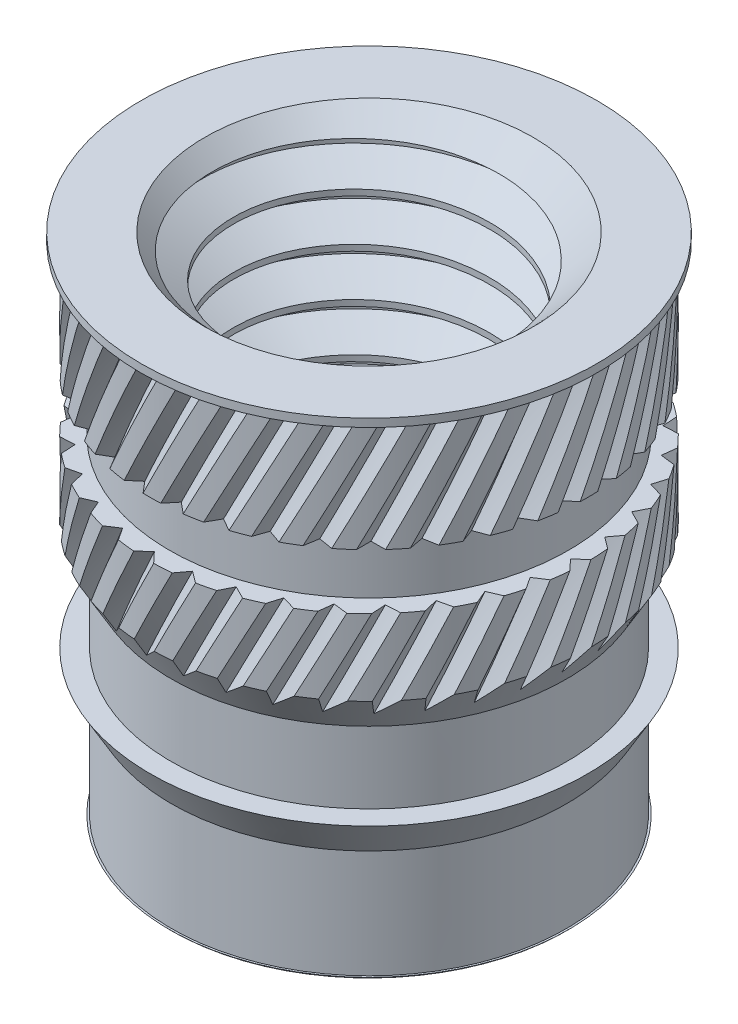
from build123d import *

# Parameters (mm, degrees)
SKETCH1_R         = 6.2
EXTRUDE1_DEPTH    = 15.88
SKETCH1_4_R       = 6.86
EXTRUDE2_DEPTH    = 7.89827
SKETCH1_3_R       = 7.15
EXTRUDE3_DEPTH    = 0.254
SKETCH2_R         = 6.86
EXTRUDE4_DEPTH    = 1.143154
EXTRUDE4_TAPER    = 30
SKETCH8_R         = 4.025721421
EXTRUDE6_DEPTH    = 15.88
CHAMFER1_SIZE     = 1.125
CUT_SWEEP1_PITCH  = 1.5
CUT_SWEEP2_PITCH  = 86.835
CIRPATTERN1_COUNT = 36
SKETCH11_W        = 0.89
SKETCH11_H        = 1.7367


with BuildPart() as part:
    # Sketch1 → Extrude1 (new body)
    with BuildSketch(Plane(origin=(0, 0, 0), x_dir=(1, 0, 0), z_dir=(0, 1, 0))):
        with Locations(Location((0, 0, 0), (0, 0, 270))):
            Circle(SKETCH1_R)
    extrude(amount=-EXTRUDE1_DEPTH)

    # Sketch1<4> → Extrude2 (add)
    with BuildSketch(Plane(origin=(0, 0, 0), x_dir=(1, 0, 0), z_dir=(0, 1, 0))):
        with Locations(Location((0, 0, 0), (0, 0, 270))):
            Circle(SKETCH1_4_R)
    extrude(amount=-EXTRUDE2_DEPTH)

    # Sketch1<3> → Extrude3 (add)
    with BuildSketch(Plane(origin=(0, 0, 0), x_dir=(1, 0, 0), z_dir=(0, 1, 0))):
        with Locations(Location((0, 0, 0), (0, 0, 270))):
            Circle(SKETCH1_3_R)
    extrude(amount=-EXTRUDE3_DEPTH)

    # Sketch2 → Extrude4 (add)
    with BuildSketch(Plane.XZ.offset(7.898269515)):
        with Locations(Location((0, 0, 0), (0, 0, 90))):
            Circle(SKETCH2_R)
    extrude(amount=EXTRUDE4_DEPTH, taper=EXTRUDE4_TAPER)

    # Extrude5: read off the stored shape, not the designer's step
    # Extrude5 outline → Extrude5 (revolve)
    with BuildSketch(Plane.XY):
        Polygon((6.2, -15.82), (6.2, -15.88), (6.26, -15.82), align=None)
    revolve(axis=Axis((0, 0, 0), (0, 1, 0)))

    # Sketch5 → Revolve1 (revolve)
    with BuildSketch(Plane.XY):
        Polygon((-6.2, -12.430711524), (-6.86, -11.287557991), (-6.2, -11.287557991), align=None)
    revolve(axis=Axis((0, 0, 0), (0, -1, 0)))

    # Sketch8 → Extrude6 (cut)
    with BuildSketch(Plane(origin=(0, 0, 0), x_dir=(1, 0, 0), z_dir=(0, 1, 0))):
        with Locations(Location((0, 0, 0), (0, 0, 270))):
            Circle(SKETCH8_R)
    extrude(amount=-EXTRUDE6_DEPTH, mode=Mode.SUBTRACT)

    # Chamfer1
    chamfer1_edges = [part.edges().sort_by_distance(p)[0] for p in [
        (0, -15.88, -4.025721421),
        (0, 0, -4.025721421),
    ]]
    chamfer(chamfer1_edges, length=CHAMFER1_SIZE)

    # Cut-Sweep1: arcs per turn and ends read off the stored shape
    # Cut-Sweep1: the profile of Sketch7 screwed along a right-hand helix through 11.796106 turns, 8 arcs to a turn; built about Z, then put on its axis
    cut_sweep1_z = Axis((0, 0, 0), (0, 0, 1))
    cut_sweep1_corners = [(5, 0, -0.75), (5, 0, -0.5625), (3.944531539, 0, 0.046875), (3.944531539, 0, -1.359375)]
    with BuildLine(mode=Mode.PRIVATE) as cut_sweep1_profile:
        Line(cut_sweep1_corners[0], cut_sweep1_corners[1])
        Line(cut_sweep1_corners[1], cut_sweep1_corners[2])
        Line(cut_sweep1_corners[2], cut_sweep1_corners[3])
        Line(cut_sweep1_corners[3], cut_sweep1_corners[0])
    cut_sweep1_cap = Face(cut_sweep1_profile.wire())
    cut_sweep1_turn_angles = [0, 22.5, 45, 67.5, 90, 112.5, 135, 157.5, 180, 202.5, 225, 247.5, 270, 292.5, 315, 337.5, 360]
    cut_sweep1_turn_weights = [1, 0.9238795325112867, 1, 0.9238795325112867, 1, 0.9238795325112867, 1, 0.9238795325112867, 1, 0.9238795325112867, 1, 0.9238795325112867, 1, 0.9238795325112867, 1, 0.9238795325112867, 1]
    cut_sweep1_turn_rails = [Edge.make_bspline([Vector(p[0], p[1], 0).rotate(cut_sweep1_z, cut_sweep1_turn_angles[k]) / cut_sweep1_turn_weights[k] + Vector(0, 0, p[2] + CUT_SWEEP1_PITCH * cut_sweep1_turn_angles[k] / 360) for k in range(17)], [0, 0, 0, 1, 1, 2, 2, 3, 3, 4, 4, 5, 5, 6, 6, 7, 7, 8, 8, 8], 2, cut_sweep1_turn_weights) for p in cut_sweep1_corners]
    cut_sweep1_turn_sides = [Face.make_surface_from_curves(cut_sweep1_turn_rails[p[0]], cut_sweep1_turn_rails[p[1]]) for p in [(0, 1), (1, 2), (2, 3), (3, 0)]]
    cut_sweep1_last_angles = [3960, 3982.5, 4005, 4027.5, 4050, 4072.5, 4095, 4117.5, 4140, 4162.5, 4185, 4207.5, 4230, 4238.299111843, 4246.598223686]
    cut_sweep1_last_weights = [1, 0.9238795325112867, 1, 0.9238795325112867, 1, 0.9238795325112867, 1, 0.9238795325112867, 1, 0.9238795325112867, 1, 0.9238795325112867, 1, 0.9895280266534215, 1]
    cut_sweep1_last_rails = [Edge.make_bspline([Vector(p[0], p[1], 0).rotate(cut_sweep1_z, cut_sweep1_last_angles[k]) / cut_sweep1_last_weights[k] + Vector(0, 0, p[2] + CUT_SWEEP1_PITCH * cut_sweep1_last_angles[k] / 360) for k in range(15)], [0, 0, 0, 1, 1, 2, 2, 3, 3, 4, 4, 5, 5, 6, 6, 7, 7, 7], 2, cut_sweep1_last_weights) for p in cut_sweep1_corners]
    cut_sweep1_last_sides = [Face.make_surface_from_curves(cut_sweep1_last_rails[p[0]], cut_sweep1_last_rails[p[1]]) for p in [(0, 1), (1, 2), (2, 3), (3, 0)]]
    cut_sweep1 = Plane(origin=(0, 0, 0), x_dir=(-1, 0, 0), z_dir=(0, -1, 0)) * Solid(Shell([*[p.moved(Location((0, 0, CUT_SWEEP1_PITCH * i))) for i in range(11) for p in cut_sweep1_turn_sides], *cut_sweep1_last_sides, cut_sweep1_cap, cut_sweep1_cap.rotate(cut_sweep1_z, 4246.598223686).moved(Location((0, 0, CUT_SWEEP1_PITCH * 4246.598223686 / 360)))]))
    add(cut_sweep1, mode=Mode.SUBTRACT)

    # Cut-Sweep2: arcs per turn and ends read off the stored shape
    # Cut-Sweep2: the profile of Sketch10 screwed along a right-hand helix through 0.1 turns, 32 arcs to a turn; built about Z, then put on its axis
    cut_sweep2_z = Axis((0, 0, 0), (0, 0, 1))
    cut_sweep2_corners = [(6.53, 0, 0), (6.86, 0.33, 0), (6.86, -0.33, 0)]
    with BuildLine(mode=Mode.PRIVATE) as cut_sweep2_profile:
        Line(cut_sweep2_corners[0], cut_sweep2_corners[1])
        Line(cut_sweep2_corners[1], cut_sweep2_corners[2])
        Line(cut_sweep2_corners[2], cut_sweep2_corners[0])
    cut_sweep2_cap = Face(cut_sweep2_profile.wire())
    cut_sweep2_turn_angles = [0, 5.625, 11.25, 16.875, 22.5, 28.125, 33.75, 34.875, 36]
    cut_sweep2_turn_weights = [1, 0.9951847266721969, 1, 0.9951847266721969, 1, 0.9951847266721969, 1, 0.9998072404820648, 1]
    cut_sweep2_turn_rails = [Edge.make_bspline([Vector(p[0], p[1], 0).rotate(cut_sweep2_z, cut_sweep2_turn_angles[k]) / cut_sweep2_turn_weights[k] + Vector(0, 0, p[2] + CUT_SWEEP2_PITCH * cut_sweep2_turn_angles[k] / 360) for k in range(9)], [0, 0, 0, 1, 1, 2, 2, 3, 3, 4, 4, 4], 2, cut_sweep2_turn_weights) for p in cut_sweep2_corners]
    cut_sweep2_turn_sides = [Face.make_surface_from_curves(cut_sweep2_turn_rails[p[0]], cut_sweep2_turn_rails[p[1]]) for p in [(0, 1), (1, 2), (2, 0)]]
    cut_sweep2 = Plane(origin=(0, -0.254, 0), x_dir=(0, 0, 1), z_dir=(0, -1, 0)) * Solid(Shell([*cut_sweep2_turn_sides, cut_sweep2_cap, cut_sweep2_cap.rotate(cut_sweep2_z, 36).moved(Location((0, 0, CUT_SWEEP2_PITCH * 36 / 360)))]))
    add(cut_sweep2, mode=Mode.SUBTRACT)

    # CirPattern1: Cut-Sweep2 ×36 about axis
    cirpattern1_axis = Axis((0, -7.898269515, 0), (0, 1, 0))
    for i in range(1, CIRPATTERN1_COUNT):
        add(cut_sweep2.rotate(cirpattern1_axis, i * 360 / CIRPATTERN1_COUNT), mode=Mode.SUBTRACT)

    # Sketch11 → Cut-Revolve1 (revolve, cut)
    with BuildSketch(Plane.XY):
        with Locations((-6.705, -4.647711524)):
            Rectangle(SKETCH11_W, SKETCH11_H)
    revolve(axis=Axis((0, 0, 0), (0, -1, 0)), mode=Mode.SUBTRACT)


solid = part.part
